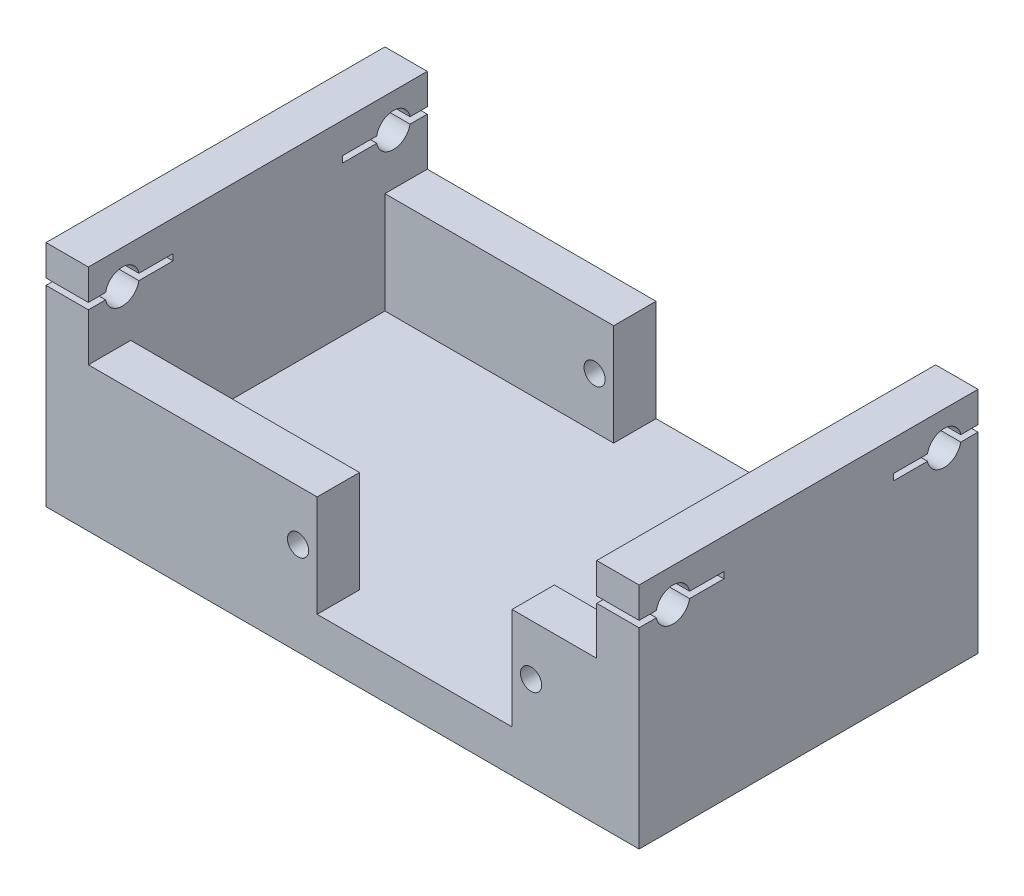
from build123d import *

# Parameters (mm, degrees)
SKETCH1_W               = 70
SKETCH1_H               = 40
BOSS_EXTRUDE1_DEPTH     = 5
BOSS_EXTRUDE2_DEPTH     = 12
SKETCH3_W               = 5
SKETCH3_H               = 40
BOSS_EXTRUDE3_DEPTH     = 10
SKETCH5_R               = 2
CUT_EXTRUDE1_DEPTH      = 78.646635471
CUT_EXTRUDE3_DEPTH      = 57.382621436
CUT_EXTRUDE3_DEPTH_BACK = 57.382621436
SKETCH7_R               = 1.25
SKETCH8_W               = 10
SKETCH8_H               = 0.75
CUT_EXTRUDE4_DEPTH      = 78.646635471


with BuildPart() as part:
    # Sketch1 → Boss-Extrude1 (new body)
    with BuildSketch(Plane(origin=(0, 0, 0), x_dir=(1, 0, 0), z_dir=(0, 1, 0))):
        Rectangle(SKETCH1_W, SKETCH1_H)
    extrude(amount=BOSS_EXTRUDE1_DEPTH)

    # Sketch2 → Boss-Extrude2 (add)
    with BuildSketch(Plane(origin=(0, 5, 0), x_dir=(1, 0, 0), z_dir=(0, 1, 0))):
        Polygon((-3, -20), (-3, -15), (-30, -15), (-30, 15), (-3, 15), (-3, 20), (-35, 20), (-35, -20), align=None)
        Polygon((20, -15), (30, -15), (30, 15), (20, 15), (20, 20), (35, 20), (35, -20), (20, -20), align=None)
    extrude(amount=BOSS_EXTRUDE2_DEPTH)

    # Sketch3 → Boss-Extrude3 (add)
    with BuildSketch(Plane(origin=(0, 17, 0), x_dir=(1, 0, 0), z_dir=(0, 1, 0))):
        with Locations((32.5, 0)):
            Rectangle(SKETCH3_W, SKETCH3_H)
        with Locations((-32.5, 0)):
            Rectangle(SKETCH3_W, SKETCH3_H)
    extrude(amount=BOSS_EXTRUDE3_DEPTH)

    # Sketch5 → Cut-Extrude1 (cut, through all)
    with BuildSketch(Plane.ZY.offset(35)):
        with Locations((16, 23)):
            Circle(SKETCH5_R)
        with Locations((-16, 23)):
            Circle(SKETCH5_R)
    extrude(amount=-CUT_EXTRUDE1_DEPTH, mode=Mode.SUBTRACT)

    # Sketch7 → Cut-Extrude3 (cut, two sides: drawn at the far end of the back side and taken through both)
    with BuildSketch(Plane(origin=(0, 0, 15), x_dir=(-1, 0, 0), z_dir=(0, 0, -1)).offset(-CUT_EXTRUDE3_DEPTH_BACK)):
        with Locations((-22.25, 11)):
            Circle(SKETCH7_R)
        with Locations((5.25, 11)):
            Circle(SKETCH7_R)
    extrude(amount=CUT_EXTRUDE3_DEPTH + CUT_EXTRUDE3_DEPTH_BACK, mode=Mode.SUBTRACT)

    # Sketch8 → Cut-Extrude4 (cut, through all)
    with BuildSketch(Plane.ZY.offset(35)):
        with Locations((15, 23)):
            Rectangle(SKETCH8_W, SKETCH8_H)
        with Locations((-15, 23)):
            Rectangle(SKETCH8_W, SKETCH8_H)
    extrude(amount=-CUT_EXTRUDE4_DEPTH, mode=Mode.SUBTRACT)


solid = part.part
